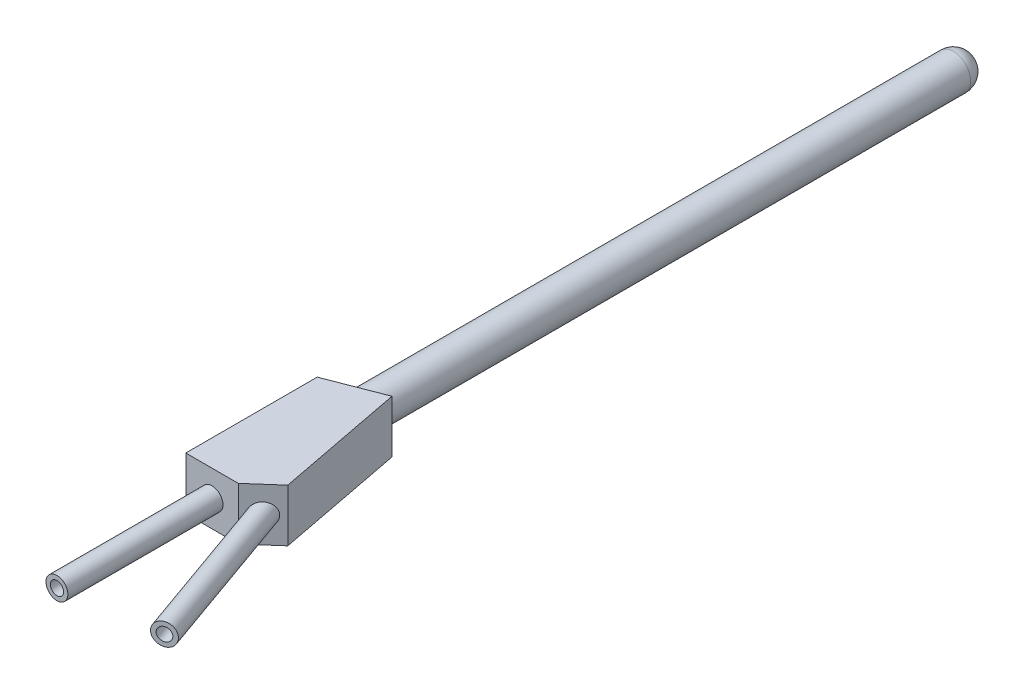
from build123d import *

# Parameters (mm, degrees)
BOSS_EXTRUDE1_DEPTH = 6
SKETCH4_R           = 2
BOSS_EXTRUDE2_DEPTH = 71.5
FILLET1_R           = 2
SKETCH5_R           = 1.25
BOSS_EXTRUDE3_DEPTH = 17.7
SKETCH7_R           = 1.25
BOSS_EXTRUDE4_DEPTH = 18.5
BOSS_EXTRUDE5_START = -5
SKETCH7_2_R         = 1.25
BOSS_EXTRUDE5_DEPTH = 5
SHELL1_T            = -0.5


with BuildPart() as part:
    # Sketch1 → Boss-Extrude1 (new body)
    with BuildSketch(Plane(origin=(0, 0, 0), x_dir=(1, 0, 0), z_dir=(0, 1, 0))):
        Polygon((0, 0), (6.158217776, 2.374100634), (9, -12.354248689), (6, -15), (0, -15), align=None)
    extrude(amount=BOSS_EXTRUDE1_DEPTH)

    # Sketch4 → Boss-Extrude2 (add)
    with BuildSketch(Plane.XY):
        with Locations((3.079108888, 3)):
            Circle(SKETCH4_R)
    extrude(amount=-BOSS_EXTRUDE2_DEPTH)

    # Fillet1
    fillet1_edges = [part.edges().sort_by_distance(p)[0] for p in [
        (1.079108888, 3, -71.5),
    ]]
    fillet(fillet1_edges, radius=FILLET1_R)

    # Sketch5 → Boss-Extrude3 (add)
    with BuildSketch(Plane.XY.offset(15)):
        with Locations((3, 3)):
            Circle(SKETCH5_R)
    extrude(amount=BOSS_EXTRUDE3_DEPTH)

    # Sketch7 → Boss-Extrude4 (add)
    with BuildSketch(Plane(origin=(7.5, 6, 13.677124344), x_dir=(0.9424618522341062, 0, -0.33431371058252735), z_dir=(0.33431371058252735, 0, 0.9424618522341062))):
        with Locations((0.000948247, -3)):
            Circle(SKETCH7_R)
    extrude(amount=BOSS_EXTRUDE4_DEPTH)

    # Sketch7<2> → Boss-Extrude5 (add)
    with BuildSketch(Plane(origin=(7.5, 6, 13.677124344), x_dir=(0.9424618522341062, 0, -0.33431371058252735), z_dir=(0.33431371058252735, 0, 0.9424618522341062)).offset(BOSS_EXTRUDE5_START)):
        with Locations((0.000948247, -3)):
            Circle(SKETCH7_2_R)
    extrude(amount=BOSS_EXTRUDE5_DEPTH)

    # Shell1
    shell1_openings = [part.faces().sort_by_distance(p)[0] for p in [
        (3, 3, 32.7),
        (13.685697333, 3, 31.112351599),
    ]]
    offset(amount=SHELL1_T, openings=shell1_openings, kind=Kind.INTERSECTION)


solid = part.part
